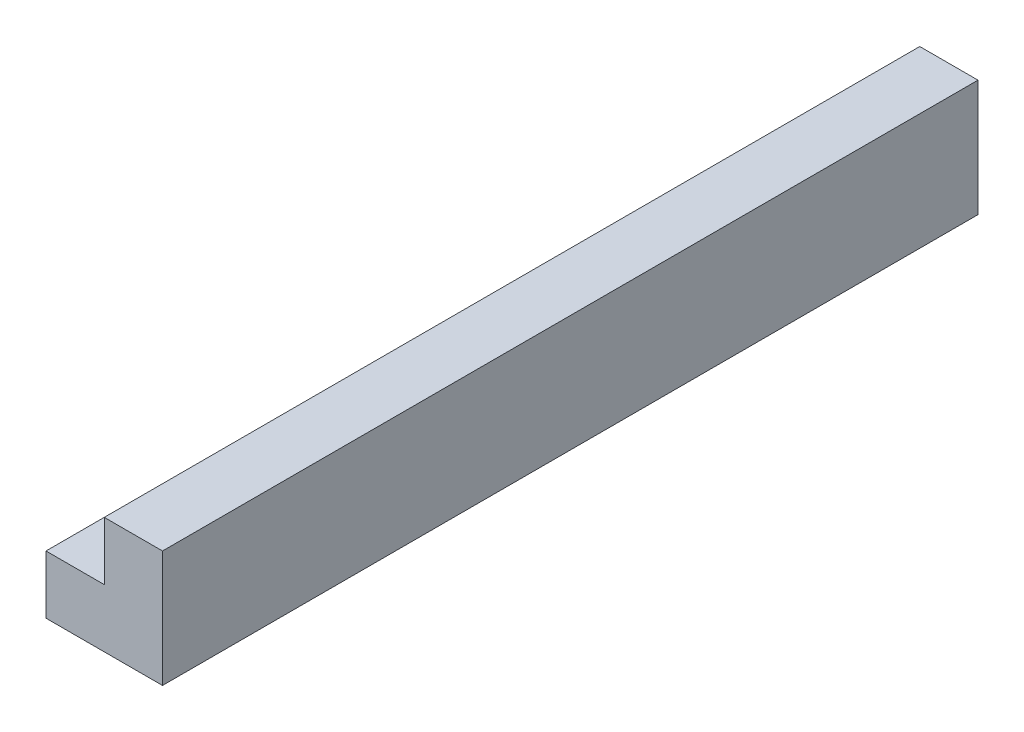
from build123d import *

# Parameters (mm, degrees)
BOSS_EXTRU_1_DEPTH = 140


with BuildPart() as part:
    # Esquisse1 → Boss.-Extru.1 (new body)
    with BuildSketch(Plane.XY):
        Polygon((0, 0), (20, 0), (20, 20), (10, 20), (10, 10), (0, 10), align=None)
    extrude(amount=BOSS_EXTRU_1_DEPTH)


solid = part.part
